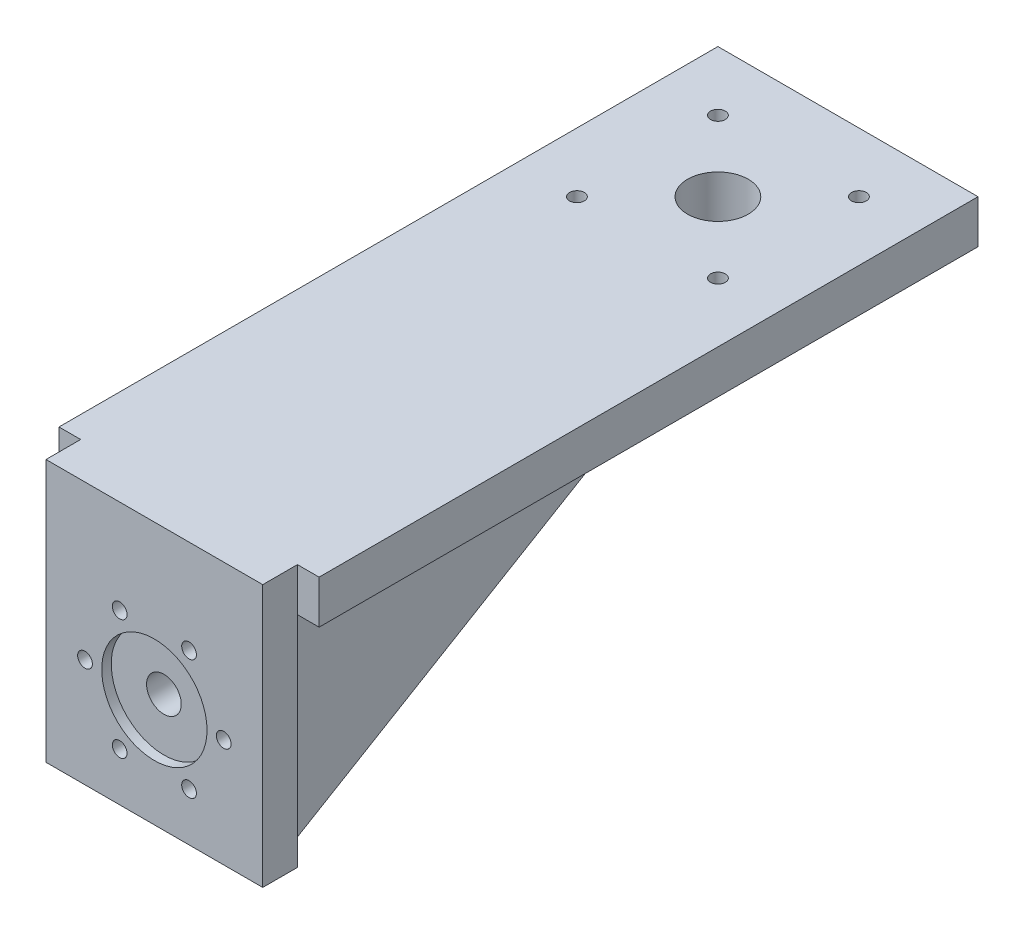
from build123d import *

# Parameters (mm, degrees)
SK_YAW_PLATE_W         = 50
SK_YAW_PLATE_H         = 60.5
SK_YAW_PLATE_R         = 1.7
SK_YAW_PLATE_R_2       = 4
YAW_PLATE_DEPTH        = 8
SK_YAW_PILOT_RECESS_R  = 12.15
YAW_PILOT_RECESS_DEPTH = 2.2
SK_ELBOW_PLATE_W       = 60
SK_ELBOW_PLATE_H       = 152
SK_ELBOW_PLATE_R       = 1.7
SK_ELBOW_PLATE_R_2     = 7
ELBOW_PLATE_DEPTH      = 10
GUSSET_FRONT_DEPTH     = 6
GUSSET_BACK_DEPTH      = 6


with BuildPart() as part:
    # SK_Yaw_Plate → Yaw_Plate (new body)
    with BuildSketch(Plane.XY.offset(-8)):
        with Locations((0, 5.25)):
            Rectangle(SK_YAW_PLATE_W, SK_YAW_PLATE_H)
        with Locations((16, 0)):
            Circle(SK_YAW_PLATE_R, mode=Mode.SUBTRACT)
        with Locations((8, -13.856406461)):
            Circle(SK_YAW_PLATE_R, mode=Mode.SUBTRACT)
        with Locations((-8, -13.856406461)):
            Circle(SK_YAW_PLATE_R, mode=Mode.SUBTRACT)
        with Locations((-16, 0)):
            Circle(SK_YAW_PLATE_R, mode=Mode.SUBTRACT)
        with Locations((-8, 13.856406461)):
            Circle(SK_YAW_PLATE_R, mode=Mode.SUBTRACT)
        with Locations((8, 13.856406461)):
            Circle(SK_YAW_PLATE_R, mode=Mode.SUBTRACT)
        Circle(SK_YAW_PLATE_R_2, mode=Mode.SUBTRACT)
    extrude(amount=YAW_PLATE_DEPTH)

    # SK_Yaw_Pilot_Recess → Yaw_Pilot_Recess (cut)
    with BuildSketch(Plane.XY):
        Circle(SK_YAW_PILOT_RECESS_R)
    extrude(amount=-YAW_PILOT_RECESS_DEPTH, mode=Mode.SUBTRACT)

    # SK_Elbow_Plate → Elbow_Plate (add)
    with BuildSketch(Plane(origin=(0, 25.5, 0), x_dir=(1, 0, 0), z_dir=(0, 1, 0))):
        with Locations((0, 84)):
            Rectangle(SK_ELBOW_PLATE_W, SK_ELBOW_PLATE_H)
        with Locations((16.263455967, 146.263455967)):
            Circle(SK_ELBOW_PLATE_R, mode=Mode.SUBTRACT)
        with Locations((-16.263455967, 146.263455967)):
            Circle(SK_ELBOW_PLATE_R, mode=Mode.SUBTRACT)
        with Locations((-16.263455967, 113.736544033)):
            Circle(SK_ELBOW_PLATE_R, mode=Mode.SUBTRACT)
        with Locations((16.263455967, 113.736544033)):
            Circle(SK_ELBOW_PLATE_R, mode=Mode.SUBTRACT)
        with Locations((0, 130)):
            Circle(SK_ELBOW_PLATE_R_2, mode=Mode.SUBTRACT)
    extrude(amount=ELBOW_PLATE_DEPTH)

    # SK_Gusset_Front → Gusset_Front (add)
    with BuildSketch(Plane(origin=(18.5, 0, 0), x_dir=(0, 0, -1), z_dir=(1, 0, 0))):
        Polygon((7.5, 26), (7.5, -20), (85, 26), align=None)
    extrude(amount=GUSSET_FRONT_DEPTH)

    # SK_Gusset_Back → Gusset_Back (add)
    with BuildSketch(Plane(origin=(-24.5, 0, 0), x_dir=(0, 0, -1), z_dir=(1, 0, 0))):
        Polygon((7.5, 26), (7.5, -20), (85, 26), align=None)
    extrude(amount=GUSSET_BACK_DEPTH)


solid = part.part
